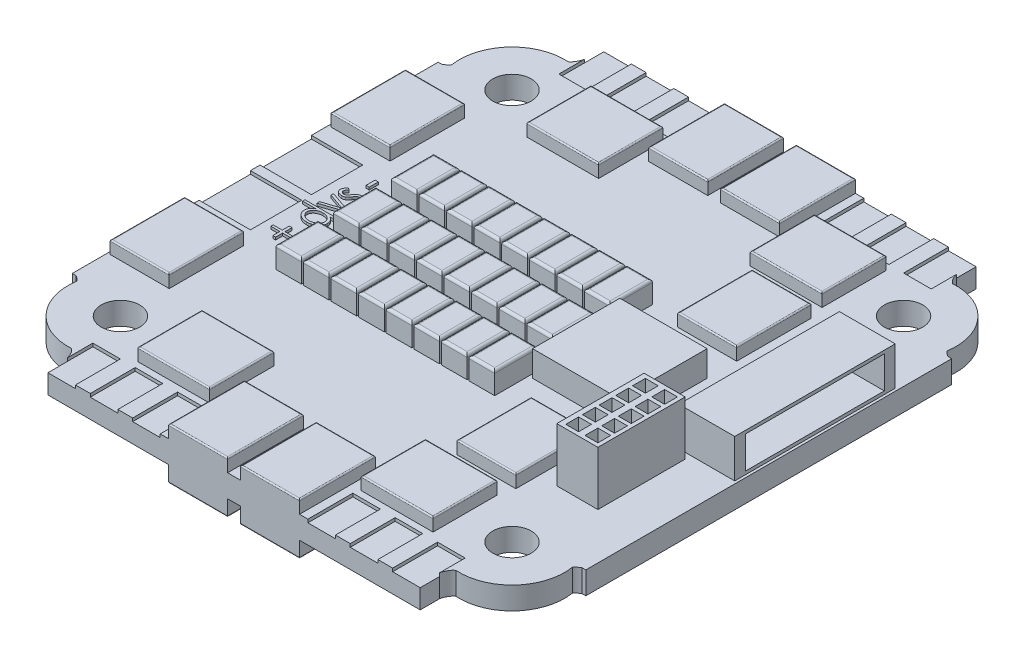
from build123d import *

# Parameters (mm, degrees)
IZIM1_W                          = 40
IZIM1_H                          = 43.3
Y_KSEKLIK_EKSTR_ZYON1_DEPTH      = 1.75
IZIM2_R                          = 1.5
KES_EKSTR_ZYON1_DEPTH            = 1.75
KES_EKSTR_ZYON4_DEPTH            = 1.75
KES_EKSTR_ZYON5_START            = 1.5
IZIM5_W                          = 2.147747616
IZIM5_H                          = 3.5
IZIM5_W_2                        = 2.15
KES_EKSTR_ZYON5_DEPTH            = 1
KES_EKSTR_ZYON7_START            = 1.5
IZIM6_W                          = 4
IZIM6_H                          = 4
KES_EKSTR_ZYON7_DEPTH            = 1
Y_KSEKLIK_EKSTR_ZYON2_DEPTH      = 2.75
Y_KSEKLIK_EKSTR_ZYON2_DEPTH_BACK = 1.25
IZIM7_W                          = 4.6
IZIM7_H                          = 5.8
IZIM9_W                          = 6.8
IZIM9_H                          = 6.8
Y_KSEKLIK_EKSTR_ZYON3_DEPTH      = 3.75
Y_KSEKLIK_EKSTR_ZYON4_DEPTH      = 2.75
Y_KSEKLIK_EKSTR_ZYON4_DEPTH_BACK = 1.25
IZIM10_W                         = 4.597884631
IZIM10_H                         = 5.9
IZIM10_W_2                       = 5.59620667
IZIM10_H_2                       = 5
IZIM11_W                         = 4
IZIM11_H                         = 4
KES_EKSTR_ZYON8_DEPTH            = 0.5
Y_KSEKLIK_EKSTR_ZYON5_START      = 1.75
IZIM12_W                         = 4.35
IZIM12_H                         = 12.5
Y_KSEKLIK_EKSTR_ZYON5_DEPTH      = 3
IZIM13_W                         = 10.8
IZIM13_H                         = 2.5
KES_EKSTR_ZYON9_DEPTH            = 13
Y_KSEKLIK_EKSTR_ZYON6_START      = 1.75
IZIM14_W                         = 3.2
IZIM14_H                         = 6.8
Y_KSEKLIK_EKSTR_ZYON6_DEPTH      = 4.2
IZIM15_W                         = 1
IZIM15_H                         = 1.002257236
KES_EKSTR_ZYON10_DEPTH           = 3
IZIM16_W                         = 2
IZIM16_H                         = 3.3
Y_KSEKLIK_EKSTR_ZYON7_DEPTH      = 3.45
RADYUS1_R                        = 0.2
RADYUS2_R                        = 0.1
IZIM17_W                         = 0.24423077
IZIM17_H                         = 0.702163462
Y_KSEKLIK_EKSTR_ZYON8_DEPTH      = 0.2


with BuildPart() as part:
    # Çizim1 → Yükseklik-Ekstrüzyon1 (new body)
    with BuildSketch(Plane(origin=(0, 0, 0), x_dir=(1, 0, 0), z_dir=(0, 1, 0))):
        Rectangle(IZIM1_W, IZIM1_H)
    extrude(amount=Y_KSEKLIK_EKSTR_ZYON1_DEPTH)

    # Çizim2 → Kes-Ekstrüzyon1 (cut)
    with BuildSketch(Plane(origin=(0, 0, 0), x_dir=(1, 0, 0), z_dir=(0, 1, 0))):
        with Locations(Location((-15.25, 15.25, 0), (0, 0, 270))):
            Circle(IZIM2_R)
        with Locations(Location((15.25, 15.25, 0), (0, 0, 270))):
            Circle(IZIM2_R)
        with Locations(Location((15.25, -15.25, 0), (0, 0, 270))):
            Circle(IZIM2_R)
        with Locations(Location((-15.25, -15.25, 0), (0, 0, 270))):
            Circle(IZIM2_R)
    extrude(amount=KES_EKSTR_ZYON1_DEPTH, mode=Mode.SUBTRACT)

    # Çizim3 → Kes-Ekstrüzyon4 (cut)
    with BuildSketch(Plane(origin=(0, 0, 0), x_dir=(1, 0, 0), z_dir=(0, 1, 0))):
        with BuildLine():
            Line((-19.717750654, 14.25), (-20, 14.25))
            Line((-20, 14.25), (-20, 21.65))
            Line((-20, 21.65), (-14.5, 21.65))
            Line((-14.5, 21.65), (-14.5, 20.13782588))
            add(Edge.make_bspline(
                [(-14.971291716, 19.340516067), (-14.753664146, 19.481272878), (-14.571354318, 19.808969024), (-14.5, 20.13782588)],
                knots=[0, 0, 0, 0, 1, 1, 1, 1], degree=3))
            ThreePointArc((-14.971291716, 19.340516067), (-18.280627176, 18.01139438), (-19.29702263, 14.593031333))
            add(Edge.make_bspline(
                [(-19.29702263, 14.593031333), (-19.433883097, 14.398452939), (-19.717750654, 14.25)],
                knots=[0, 0, 0, 1, 1, 1], degree=2))
        make_face()
        with BuildLine():
            Line((20, 21.65), (14.5, 21.65))
            Line((14.5, 21.65), (14.5, 20.13782588))
            add(Edge.make_bspline(
                [(14.971291716, 19.340516067), (14.753664146, 19.481272878), (14.571354318, 19.808969024), (14.5, 20.13782588)],
                knots=[0, 0, 0, 0, 1, 1, 1, 1], degree=3))
            ThreePointArc((14.971291716, 19.340516067), (18.280627176, 18.01139438), (19.29702263, 14.593031333))
            add(Edge.make_bspline(
                [(19.29702263, 14.593031333), (19.433883097, 14.398452939), (19.717750654, 14.25)],
                knots=[0, 0, 0, 1, 1, 1], degree=2))
            Line((19.717750654, 14.25), (20, 14.25))
            Line((20, 14.25), (20, 21.65))
        make_face()
        with BuildLine():
            Line((19.717750654, -14.25), (20, -14.25))
            Line((20, -14.25), (20, -21.65))
            Line((20, -21.65), (14.5, -21.65))
            Line((14.5, -21.65), (14.5, -20.13782588))
            add(Edge.make_bspline(
                [(14.971291716, -19.340516067), (14.753664146, -19.481272878), (14.571354318, -19.808969024), (14.5, -20.13782588)],
                knots=[0, 0, 0, 0, 1, 1, 1, 1], degree=3))
            ThreePointArc((14.971291716, -19.340516067), (18.280627176, -18.01139438), (19.29702263, -14.593031333))
            add(Edge.make_bspline(
                [(19.29702263, -14.593031333), (19.433883097, -14.398452939), (19.717750654, -14.25)],
                knots=[0, 0, 0, 1, 1, 1], degree=2))
        make_face()
        with BuildLine():
            Line((-20, -21.65), (-14.5, -21.65))
            Line((-14.5, -21.65), (-14.5, -20.13782588))
            add(Edge.make_bspline(
                [(-14.971291716, -19.340516067), (-14.753664146, -19.481272878), (-14.571354318, -19.808969024), (-14.5, -20.13782588)],
                knots=[0, 0, 0, 0, 1, 1, 1, 1], degree=3))
            ThreePointArc((-14.971291716, -19.340516067), (-18.280627176, -18.01139438), (-19.29702263, -14.593031333))
            add(Edge.make_bspline(
                [(-19.29702263, -14.593031333), (-19.433883097, -14.398452939), (-19.717750654, -14.25)],
                knots=[0, 0, 0, 1, 1, 1], degree=2))
            Line((-19.717750654, -14.25), (-20, -14.25))
            Line((-20, -14.25), (-20, -21.65))
        make_face()
    extrude(amount=KES_EKSTR_ZYON4_DEPTH, mode=Mode.SUBTRACT)

    # Çizim5 → Kes-Ekstrüzyon5 (cut)
    with BuildSketch(Plane(origin=(0, 0, 0), x_dir=(1, 0, 0), z_dir=(0, 1, 0)).offset(KES_EKSTR_ZYON5_START)):
        with Locations((-13.426126192, 19.9)):
            Rectangle(IZIM5_W, IZIM5_H)
        with Locations((-6.823873808, 19.9)):
            Rectangle(IZIM5_W, IZIM5_H)
        with Locations((-10.125, 19.9)):
            Rectangle(IZIM5_W_2, IZIM5_H)
        with Locations((10.125, 19.9)):
            Rectangle(IZIM5_W_2, IZIM5_H)
        with Locations((6.823873808, 19.9)):
            Rectangle(IZIM5_W, IZIM5_H)
        with Locations((13.426126192, 19.9)):
            Rectangle(IZIM5_W, IZIM5_H)
        with Locations((13.426126192, -19.9)):
            Rectangle(IZIM5_W, IZIM5_H)
        with Locations((6.823873808, -19.9)):
            Rectangle(IZIM5_W, IZIM5_H)
        with Locations((10.125, -19.9)):
            Rectangle(IZIM5_W_2, IZIM5_H)
        with Locations((-10.125, -19.9)):
            Rectangle(IZIM5_W_2, IZIM5_H)
        with Locations((-6.823873808, -19.9)):
            Rectangle(IZIM5_W, IZIM5_H)
        with Locations((-13.426126192, -19.9)):
            Rectangle(IZIM5_W, IZIM5_H)
    extrude(amount=KES_EKSTR_ZYON5_DEPTH, mode=Mode.SUBTRACT)

    # Çizim6 → Kes-Ekstrüzyon7 (cut)
    with BuildSketch(Plane(origin=(0, 0, 0), x_dir=(1, 0, 0), z_dir=(0, 1, 0)).offset(KES_EKSTR_ZYON7_START)):
        with Locations((-18, -2.375)):
            Rectangle(IZIM6_W, IZIM6_H)
        with Locations((-18, 2.375)):
            Rectangle(IZIM6_W, IZIM6_H)
    extrude(amount=KES_EKSTR_ZYON7_DEPTH, mode=Mode.SUBTRACT)

    # Çizim7 → Yükseklik-Ekstrüzyon2 (add, two sides: drawn at the far end of the back side and taken through both)
    with BuildSketch(Plane(origin=(0, 0, 0), x_dir=(1, 0, 0), z_dir=(0, 1, 0)).offset(-Y_KSEKLIK_EKSTR_ZYON2_DEPTH_BACK)):
        with Locations((-17.5, -8.6)):
            Rectangle(IZIM7_W, IZIM7_H)
        with Locations((-17.5, 8.6)):
            Rectangle(IZIM7_W, IZIM7_H)
        with Locations((9.5, -8.6)):
            Rectangle(IZIM7_W, IZIM7_H)
        with Locations((9.5, 8.6)):
            Rectangle(IZIM7_W, IZIM7_H)
    extrude(amount=Y_KSEKLIK_EKSTR_ZYON2_DEPTH + Y_KSEKLIK_EKSTR_ZYON2_DEPTH_BACK)

    # Çizim9 → Yükseklik-Ekstrüzyon3 (add)
    with BuildSketch(Plane(origin=(0, 0, 0), x_dir=(1, 0, 0), z_dir=(0, 1, 0))):
        with Locations((8.4, 0)):
            Rectangle(IZIM9_W, IZIM9_H)
    extrude(amount=Y_KSEKLIK_EKSTR_ZYON3_DEPTH)

    # Çizim10 → Yükseklik-Ekstrüzyon4 (add, two sides: drawn at the far end of the back side and taken through both)
    with BuildSketch(Plane(origin=(0, 0, 0), x_dir=(1, 0, 0), z_dir=(0, 1, 0)).offset(-Y_KSEKLIK_EKSTR_ZYON4_DEPTH_BACK)):
        with Locations((-2.801057685, 18.7)):
            Rectangle(IZIM10_W, IZIM10_H)
        with Locations((2.801057685, 18.7)):
            Rectangle(IZIM10_W, IZIM10_H)
        with Locations((8.701896665, 15.15)):
            Rectangle(IZIM10_W_2, IZIM10_H_2)
        with Locations((-8.701896665, 15.15)):
            Rectangle(IZIM10_W_2, IZIM10_H_2)
        with Locations((8.701896665, -15.15)):
            Rectangle(IZIM10_W_2, IZIM10_H_2)
        with Locations((-8.701896665, -15.15)):
            Rectangle(IZIM10_W_2, IZIM10_H_2)
        with Locations((-2.801057685, -18.7)):
            Rectangle(IZIM10_W, IZIM10_H)
        with Locations((2.801057685, -18.7)):
            Rectangle(IZIM10_W, IZIM10_H)
    extrude(amount=Y_KSEKLIK_EKSTR_ZYON4_DEPTH + Y_KSEKLIK_EKSTR_ZYON4_DEPTH_BACK)

    # Çizim11 → Kes-Ekstrüzyon8 (cut)
    with BuildSketch(Plane(origin=(0, 0, 0), x_dir=(1, 0, 0), z_dir=(0, 1, 0))):
        with Locations((-18.003680678, -2.654708619)):
            Rectangle(IZIM11_W, IZIM11_H)
        with Locations((-18.003680678, 2.095291381)):
            Rectangle(IZIM11_W, IZIM11_H)
    extrude(amount=KES_EKSTR_ZYON8_DEPTH, mode=Mode.SUBTRACT)

    # Çizim12 → Yükseklik-Ekstrüzyon5 (add)
    with BuildSketch(Plane(origin=(0, 0, 0), x_dir=(1, 0, 0), z_dir=(0, 1, 0)).offset(Y_KSEKLIK_EKSTR_ZYON5_START)):
        with Locations((17.625, 3.8)):
            Rectangle(IZIM12_W, IZIM12_H)
    extrude(amount=Y_KSEKLIK_EKSTR_ZYON5_DEPTH)

    # Çizim13 → Kes-Ekstrüzyon9 (cut)
    with BuildSketch(Plane(origin=(29.8, 0, 0), x_dir=(0, 0, -1), z_dir=(1, 0, 0))):
        with Locations((3.8, 3.25)):
            Rectangle(IZIM13_W, IZIM13_H)
    extrude(amount=-KES_EKSTR_ZYON9_DEPTH, mode=Mode.SUBTRACT)

    # Çizim14 → Yükseklik-Ekstrüzyon6 (add)
    with BuildSketch(Plane(origin=(0, 0, 0), x_dir=(1, 0, 0), z_dir=(0, 1, 0)).offset(Y_KSEKLIK_EKSTR_ZYON6_START)):
        with Locations((14.8, -6.310712731)):
            Rectangle(IZIM14_W, IZIM14_H)
    extrude(amount=Y_KSEKLIK_EKSTR_ZYON6_DEPTH)

    # Çizim15 → Kes-Ekstrüzyon10 (cut)
    with BuildSketch(Plane(origin=(0, 5.95, 0), x_dir=(1, 0, 0), z_dir=(0, 1, 0))):
        with Locations((14.1, -3.711841349)):
            Rectangle(IZIM15_W, IZIM15_H)
        with Locations((15.6, -3.711841349)):
            Rectangle(IZIM15_W, IZIM15_H)
        with Locations((14.1, -5.011841349)):
            Rectangle(IZIM15_W, IZIM15_H)
        with Locations((14.1, -6.311841349)):
            Rectangle(IZIM15_W, IZIM15_H)
        with Locations((14.1, -7.611841349)):
            Rectangle(IZIM15_W, IZIM15_H)
        with Locations((14.1, -8.911841349)):
            Rectangle(IZIM15_W, IZIM15_H)
        with Locations((15.6, -5.011841349)):
            Rectangle(IZIM15_W, IZIM15_H)
        with Locations((15.6, -6.311841349)):
            Rectangle(IZIM15_W, IZIM15_H)
        with Locations((15.6, -7.611841349)):
            Rectangle(IZIM15_W, IZIM15_H)
        with Locations((15.6, -8.911841349)):
            Rectangle(IZIM15_W, IZIM15_H)
    extrude(amount=-KES_EKSTR_ZYON10_DEPTH, mode=Mode.SUBTRACT)

    # Çizim16 → Yükseklik-Ekstrüzyon7 (add)
    with BuildSketch(Plane(origin=(0, 0, 0), x_dir=(1, 0, 0), z_dir=(0, 1, 0))):
        with Locations((1.55, 4.6)):
            Rectangle(IZIM16_W, IZIM16_H)
        with Locations((3.7, 4.6)):
            Rectangle(IZIM16_W, IZIM16_H)
        with Locations((-0.6, 4.6)):
            Rectangle(IZIM16_W, IZIM16_H)
        with Locations((-2.75, 4.6)):
            Rectangle(IZIM16_W, IZIM16_H)
        with Locations((-4.9, 4.6)):
            Rectangle(IZIM16_W, IZIM16_H)
        with Locations((-7.05, 4.6)):
            Rectangle(IZIM16_W, IZIM16_H)
        with Locations((-9.2, 4.6)):
            Rectangle(IZIM16_W, IZIM16_H)
        with Locations((-11.35, 4.6)):
            Rectangle(IZIM16_W, IZIM16_H)
        with Locations((1.55, 0.1)):
            Rectangle(IZIM16_W, IZIM16_H)
        with Locations((-0.6, 0.1)):
            Rectangle(IZIM16_W, IZIM16_H)
        with Locations((-2.75, 0.1)):
            Rectangle(IZIM16_W, IZIM16_H)
        with Locations((-4.9, 0.1)):
            Rectangle(IZIM16_W, IZIM16_H)
        with Locations((-7.05, 0.1)):
            Rectangle(IZIM16_W, IZIM16_H)
        with Locations((-9.2, 0.1)):
            Rectangle(IZIM16_W, IZIM16_H)
        with Locations((-11.35, 0.1)):
            Rectangle(IZIM16_W, IZIM16_H)
        with Locations((1.55, -4.4)):
            Rectangle(IZIM16_W, IZIM16_H)
        with Locations((-0.6, -4.4)):
            Rectangle(IZIM16_W, IZIM16_H)
        with Locations((-2.75, -4.4)):
            Rectangle(IZIM16_W, IZIM16_H)
        with Locations((-4.9, -4.4)):
            Rectangle(IZIM16_W, IZIM16_H)
        with Locations((-7.05, -4.4)):
            Rectangle(IZIM16_W, IZIM16_H)
        with Locations((-9.2, -4.4)):
            Rectangle(IZIM16_W, IZIM16_H)
        with Locations((-11.35, -4.4)):
            Rectangle(IZIM16_W, IZIM16_H)
        with Locations((3.7, 0.1)):
            Rectangle(IZIM16_W, IZIM16_H)
        with Locations((3.7, -4.4)):
            Rectangle(IZIM16_W, IZIM16_H)
    extrude(amount=Y_KSEKLIK_EKSTR_ZYON7_DEPTH)

    # Radyus1
    radyus1_edges = [part.edges().sort_by_distance(p)[0] for p in [
        (0.4, 3.45, -0.1),
        (-0.6, 3.45, -1.75),
        (-1.6, 3.45, -0.1),
        (-0.6, 3.45, 1.55),
        (-1.75, 3.45, -0.1),
        (-2.75, 3.45, -1.75),
        (-3.75, 3.45, -0.1),
        (-2.75, 3.45, 1.55),
        (-3.9, 3.45, -0.1),
        (-4.9, 3.45, -1.75),
        (-5.9, 3.45, -0.1),
        (-4.9, 3.45, 1.55),
        (-6.05, 3.45, -0.1),
        (-7.05, 3.45, -1.75),
        (-8.05, 3.45, -0.1),
        (-7.05, 3.45, 1.55),
        (-8.2, 3.45, -0.1),
        (-9.2, 3.45, -1.75),
        (-10.2, 3.45, -0.1),
        (-9.2, 3.45, 1.55),
        (-10.35, 3.45, -0.1),
        (-11.35, 3.45, -1.75),
        (-12.35, 3.45, -0.1),
        (-11.35, 3.45, 1.55),
        (2.55, 3.45, 4.4),
        (1.55, 3.45, 2.75),
        (0.55, 3.45, 4.4),
        (1.55, 3.45, 6.05),
        (0.4, 3.45, 4.4),
        (-0.6, 3.45, 2.75),
        (-1.6, 3.45, 4.4),
        (-0.6, 3.45, 6.05),
        (-1.75, 3.45, 4.4),
        (-2.75, 3.45, 2.75),
        (-3.75, 3.45, 4.4),
        (-2.75, 3.45, 6.05),
        (-3.9, 3.45, 4.4),
        (-4.9, 3.45, 2.75),
        (-5.9, 3.45, 4.4),
        (-4.9, 3.45, 6.05),
        (-6.05, 3.45, 4.4),
        (-7.05, 3.45, 2.75),
        (-8.05, 3.45, 4.4),
        (-7.05, 3.45, 6.05),
        (-8.2, 3.45, 4.4),
        (-9.2, 3.45, 2.75),
        (-10.2, 3.45, 4.4),
        (-9.2, 3.45, 6.05),
        (-10.35, 3.45, 4.4),
        (-11.35, 3.45, 2.75),
        (-12.35, 3.45, 4.4),
        (-11.35, 3.45, 6.05),
        (4.7, 3.45, -0.1),
        (3.7, 3.45, -1.75),
        (2.7, 3.45, -0.1),
        (3.7, 3.45, 1.55),
        (4.7, 3.45, 4.4),
        (3.7, 3.45, 2.75),
        (2.7, 3.45, 4.4),
        (3.7, 3.45, 6.05),
        (4.7, 3.45, -4.6),
        (3.7, 3.45, -6.25),
        (2.7, 3.45, -4.6),
        (3.7, 3.45, -2.95),
        (2.55, 3.45, -4.6),
        (1.55, 3.45, -6.25),
        (0.55, 3.45, -4.6),
        (1.55, 3.45, -2.95),
        (0.4, 3.45, -4.6),
        (-0.6, 3.45, -6.25),
        (-1.6, 3.45, -4.6),
        (-0.6, 3.45, -2.95),
        (-1.75, 3.45, -4.6),
        (-2.75, 3.45, -6.25),
        (-3.75, 3.45, -4.6),
        (-2.75, 3.45, -2.95),
        (-3.9, 3.45, -4.6),
        (-4.9, 3.45, -6.25),
        (-5.9, 3.45, -4.6),
        (-4.9, 3.45, -2.95),
        (-6.05, 3.45, -4.6),
        (-7.05, 3.45, -6.25),
        (-8.05, 3.45, -4.6),
        (-7.05, 3.45, -2.95),
        (-8.2, 3.45, -4.6),
        (-9.2, 3.45, -6.25),
        (-10.2, 3.45, -4.6),
        (-9.2, 3.45, -2.95),
        (-10.35, 3.45, -4.6),
        (-11.35, 3.45, -6.25),
        (-12.35, 3.45, -4.6),
        (-11.35, 3.45, -2.95),
        (2.55, 3.45, -0.1),
        (1.55, 3.45, -1.75),
        (0.55, 3.45, -0.1),
        (1.55, 3.45, 1.55),
    ]]
    fillet(radyus1_edges, radius=RADYUS1_R)

    # Radyus2
    radyus2_edges = [part.edges().sort_by_distance(p)[0] for p in [
        (-15.2, -1.25, 8.6),
        (-17.5, -1.25, 11.5),
        (-19.8, -1.25, 8.6),
        (-17.5, -1.25, 5.7),
        (-15.2, 2.75, 8.6),
        (-17.5, 2.75, 5.7),
        (-19.8, 2.75, 8.6),
        (-17.5, 2.75, 11.5),
        (-15.2, -1.25, -8.6),
        (-17.5, -1.25, -5.7),
        (-19.8, -1.25, -8.6),
        (-17.5, -1.25, -11.5),
        (-15.2, 2.75, -8.6),
        (-17.5, 2.75, -11.5),
        (-19.8, 2.75, -8.6),
        (-17.5, 2.75, -5.7),
        (9.5, -1.25, 11.5),
        (7.2, -1.25, 8.6),
        (9.5, -1.25, 5.7),
        (11.8, -1.25, 8.6),
        (9.5, 2.75, 11.5),
        (11.8, 2.75, 8.6),
        (9.5, 2.75, 5.7),
        (7.2, 2.75, 8.6),
        (9.5, -1.25, -11.5),
        (11.8, -1.25, -8.6),
        (9.5, -1.25, -5.7),
        (7.2, -1.25, -8.6),
        (9.5, 2.75, -11.5),
        (7.2, 2.75, -8.6),
        (9.5, 2.75, -5.7),
        (11.8, 2.75, -8.6),
        (-5.1, 2.75, -18.7),
        (-2.801057684, 2.75, -15.75),
        (-0.502115369, 2.75, -18.7),
        (-2.801057684, 2.75, -21.65),
        (2.801057684, 2.75, -15.75),
        (5.1, 2.75, -18.7),
        (2.801057684, 2.75, -21.65),
        (0.502115369, 2.75, -18.7),
        (-11.5, -1.25, -15.15),
        (-8.701896665, -1.25, -17.65),
        (-5.90379333, -1.25, -15.15),
        (-8.701896665, -1.25, -12.65),
        (-11.5, 2.75, -15.15),
        (-8.701896665, 2.75, -12.65),
        (-5.90379333, 2.75, -15.15),
        (-8.701896665, 2.75, -17.65),
        (8.701896665, -1.25, -12.65),
        (5.90379333, -1.25, -15.15),
        (8.701896665, -1.25, -17.65),
        (11.5, -1.25, -15.15),
        (8.701896665, 2.75, -12.65),
        (11.5, 2.75, -15.15),
        (8.701896665, 2.75, -17.65),
        (5.90379333, 2.75, -15.15),
        (11.5, -1.25, 15.15),
        (8.701896665, -1.25, 17.65),
        (5.90379333, -1.25, 15.15),
        (8.701896665, -1.25, 12.65),
        (11.5, 2.75, 15.15),
        (8.701896665, 2.75, 12.65),
        (5.90379333, 2.75, 15.15),
        (8.701896665, 2.75, 17.65),
        (-11.5, -1.25, 15.15),
        (-8.701896665, -1.25, 12.65),
        (-5.90379333, -1.25, 15.15),
        (-8.701896665, -1.25, 17.65),
        (-11.5, 2.75, 15.15),
        (-8.701896665, 2.75, 17.65),
        (-5.90379333, 2.75, 15.15),
        (-8.701896665, 2.75, 12.65),
        (2.801057684, -1.25, 21.65),
        (0.502115369, -1.25, 18.7),
        (2.801057684, -1.25, 15.75),
        (5.1, -1.25, 18.7),
        (2.801057684, 2.75, 21.65),
        (5.1, 2.75, 18.7),
        (2.801057684, 2.75, 15.75),
        (0.502115369, 2.75, 18.7),
        (-2.801057684, -1.25, 15.75),
        (-0.502115369, -1.25, 18.7),
        (-2.801057684, -1.25, 21.65),
        (-5.1, -1.25, 18.7),
        (-2.801057684, 2.75, 15.75),
        (-5.1, 2.75, 18.7),
        (-2.801057684, 2.75, 21.65),
        (-0.502115369, 2.75, 18.7),
    ]]
    fillet(radyus2_edges, radius=RADYUS2_R)

    # Çizim17 → Yükseklik-Ekstrüzyon8 (add)
    # profile 1 of 5: a face of its own
    with BuildSketch(Plane(origin=(0, 1.75, 0), x_dir=(1, 0, 0), z_dir=(0, 1, 0))):
        Polygon((-14.545757748, -3.534220415), (-15.247921209, -3.534220415), (-15.247921209, -3.351047338), (-14.545757748, -3.351047338), (-14.545757748, -2.801528107), (-14.332055825, -2.801528107), (-14.332055825, -3.351047338), (-13.629892363, -3.351047338), (-13.629892363, -3.534220415), (-14.332055825, -3.534220415), (-14.332055825, -4.083739645), (-14.545757748, -4.083739645), align=None)
    # profile 2 of 5: a face of its own
    with BuildSketch(Plane(origin=(0, 1.75, 0), x_dir=(1, 0, 0), z_dir=(0, 1, 0))):
        with BuildLine():
            Line((-15.705853902, -0.420278107), (-13.263546209, -0.420278107))
            Line((-13.263546209, -0.420278107), (-13.263546209, -0.603451184))
            Line((-13.263546209, -0.603451184), (-13.564541552, -0.603451184))
            add(Edge.make_bspline(
                [(-13.564541552, -0.603451184), (-13.53746896, -0.622039409), (-13.485206737, -0.657923005), (-13.415276505, -0.717920722), (-13.357973194, -0.782577607), (-13.311447669, -0.850219237), (-13.276384877, -0.92156596), (-13.251512393, -0.995845728), (-13.235399772, -1.073252432), (-13.233818078, -1.126177633), (-13.233017363, -1.152970415)],
                knots=[0, 0, 0, 0, 1.172747878, 2.263928442, 3.281922024, 4.25087268, 5.188273431, 6.111575823, 7.044006704, 8, 8, 8, 8], degree=3))
            add(Edge.make_bspline(
                [(-13.233017363, -1.152970415), (-13.233851804, -1.176876084), (-13.235498799, -1.224060412), (-13.248319133, -1.293283332), (-13.268974441, -1.359738997), (-13.297844754, -1.423728702), (-13.335207201, -1.484904231), (-13.381215798, -1.542968139), (-13.435037905, -1.598587724), (-13.496490458, -1.650815016), (-13.563766709, -1.698552984), (-13.635064437, -1.740903658), (-13.710308742, -1.776321186), (-13.789292543, -1.804823982), (-13.871611769, -1.827271661), (-13.957388291, -1.843571182), (-14.046742426, -1.853149529), (-14.107518572, -1.854465472), (-14.138388457, -1.855133876)],
                knots=[0, 0, 0, 0, 0.903163779, 1.78263887, 2.651389892, 3.528335299, 4.429236434, 5.353843816, 6.32297284, 7.350379706, 8.397704944, 9.43776181, 10.480939894, 11.536168289, 12.607837322, 13.702913536, 14.833246301, 16, 16, 16, 16], degree=3))
            add(Edge.make_bspline(
                [(-14.138388457, -1.855133876), (-14.16862298, -1.854462767), (-14.228289742, -1.853138356), (-14.316052745, -1.84355125), (-14.400622454, -1.827316159), (-14.481653373, -1.804398577), (-14.559507991, -1.775318543), (-14.633660184, -1.739115665), (-14.705001104, -1.697348132), (-14.771711501, -1.648855802), (-14.83273915, -1.596068044), (-14.886497813, -1.540095364), (-14.932478433, -1.481777235), (-14.969345382, -1.420032406), (-14.998831008, -1.356038427), (-15.019511317, -1.289019636), (-15.0315588, -1.219392803), (-15.033326256, -1.172097059), (-15.034219286, -1.148200282)],
                knots=[0, 0, 0, 0, 1.147764703, 2.265073058, 3.347188514, 4.413563271, 5.458552615, 6.498034846, 7.542675396, 8.593229709, 9.624528646, 10.602280619, 11.535718512, 12.43746343, 13.326263971, 14.204609005, 15.092855845, 16, 16, 16, 16], degree=3))
            add(Edge.make_bspline(
                [(-15.034219286, -1.148200282), (-15.03315849, -1.120757521), (-15.031064667, -1.066590363), (-15.01317639, -0.987458727), (-14.984448014, -0.912314174), (-14.94366916, -0.841261231), (-14.891068499, -0.774827569), (-14.827191093, -0.712360964), (-14.752192023, -0.653963462), (-14.695944499, -0.62064467), (-14.666919106, -0.603451184)],
                knots=[0, 0, 0, 0, 0.951594992, 1.878280231, 2.800748451, 3.735175227, 4.710076232, 5.732587844, 6.829948001, 8, 8, 8, 8], degree=3))
            Line((-14.666919106, -0.603451184), (-15.705853902, -0.603451184))
            Line((-15.705853902, -0.603451184), (-15.705853902, -0.420278107))
        make_face()
        with BuildLine():
            add(Edge.make_bspline(
                [(-14.820517363, -1.137228978), (-14.819420258, -1.161023437), (-14.817249774, -1.208097783), (-14.799623284, -1.277242554), (-14.771320096, -1.34337394), (-14.73178181, -1.406213771), (-14.682054964, -1.464079491), (-14.623355784, -1.516871119), (-14.554690888, -1.561812428), (-14.479109207, -1.601284999), (-14.397338434, -1.632292486), (-14.312417071, -1.655431692), (-14.224844805, -1.669018012), (-14.165782893, -1.670974382), (-14.136003391, -1.671960799)],
                knots=[0, 0, 0, 0, 0.890056594, 1.76086514, 2.654499465, 3.574716069, 4.529255787, 5.503372661, 6.520644566, 7.593881512, 8.690822744, 9.788539383, 10.884963373, 12, 12, 12, 12], degree=3))
            add(Edge.make_bspline(
                [(-14.136003391, -1.671960799), (-14.106383807, -1.670964688), (-14.047482925, -1.668983843), (-13.960213701, -1.655487686), (-13.875117445, -1.632168295), (-13.793038322, -1.600687807), (-13.71623337, -1.561431133), (-13.646783803, -1.515881745), (-13.587240459, -1.462844067), (-13.536835274, -1.404592593), (-13.496604567, -1.342036865), (-13.468158298, -1.27609803), (-13.449932596, -1.208009264), (-13.447792757, -1.161509865), (-13.446719286, -1.138183005)],
                knots=[0, 0, 0, 0, 1.107208297, 2.201771173, 3.291886461, 4.400195165, 5.482177094, 6.510909783, 7.496205014, 8.452991324, 9.383017846, 10.264216512, 11.12922794, 12, 12, 12, 12], degree=3))
            add(Edge.make_bspline(
                [(-13.446719286, -1.138183005), (-13.447857026, -1.114713854), (-13.450130437, -1.067818208), (-13.467574577, -0.998420579), (-13.496607555, -0.931354073), (-13.536409411, -0.867162241), (-13.58521454, -0.807222349), (-13.642903693, -0.753971717), (-13.708719341, -0.708130713), (-13.782127021, -0.670339639), (-13.861868661, -0.640329223), (-13.946837461, -0.618978492), (-14.03668716, -0.605750756), (-14.098272569, -0.604229841), (-14.129802219, -0.603451184)],
                knots=[0, 0, 0, 0, 0.876430904, 1.751268901, 2.656380427, 3.598087967, 4.565158369, 5.536527855, 6.522331019, 7.553563889, 8.614202314, 9.699457988, 10.822200185, 12, 12, 12, 12], degree=3))
            add(Edge.make_bspline(
                [(-14.129802219, -0.603451184), (-14.15383177, -0.603886416), (-14.201046488, -0.604741587), (-14.270383846, -0.612153212), (-14.336863918, -0.623681794), (-14.400014899, -0.641286258), (-14.460590527, -0.662439066), (-14.517693317, -0.689409114), (-14.57220675, -0.720446515), (-14.622657226, -0.756481086), (-14.668834896, -0.795865133), (-14.709531274, -0.837652891), (-14.74389388, -0.881930175), (-14.771648544, -0.928646151), (-14.794103166, -0.977415029), (-14.808934522, -1.028920024), (-14.819228851, -1.082279942), (-14.820083668, -1.118733892), (-14.820517363, -1.137228978)],
                knots=[0, 0, 0, 0, 1.188172481, 2.334593263, 3.445282313, 4.521295281, 5.57350723, 6.614936672, 7.640145624, 8.672298908, 9.676294346, 10.638484653, 11.55241243, 12.441226742, 13.321194475, 14.199508958, 15.086512205, 16, 16, 16, 16], degree=3))
        make_face(mode=Mode.SUBTRACT)
    # profile 3 of 5: a face of its own
    with BuildSketch(Plane(origin=(0, 1.75, 0), x_dir=(1, 0, 0), z_dir=(0, 1, 0))):
        Polygon((-15.00369044, -0.176047338), (-15.00369044, 0.024298215), (-13.696197201, 0.453133101), (-15.00369044, 0.905818648), (-15.00369044, 1.106164201), (-12.62244044, 0.281885355), (-12.62244044, 0.081539802), (-13.399494977, 0.350098245), align=None)
    # profile 4 of 5: a face of its own
    with BuildSketch(Plane(origin=(0, 1.75, 0), x_dir=(1, 0, 0), z_dir=(0, 1, 0))):
        with BuildLine():
            Line((-14.786649424, 2.052558432), (-14.637344286, 1.939983311))
            add(Edge.make_bspline(
                [(-14.637344286, 1.939983311), (-14.651824071, 1.92890169), (-14.679626729, 1.907623852), (-14.716975331, 1.873666227), (-14.748596779, 1.839848447), (-14.774599261, 1.806398531), (-14.79527472, 1.773166291), (-14.809539041, 1.739692645), (-14.818781353, 1.7064205), (-14.819947171, 1.684200527), (-14.820517363, 1.673332921)],
                knots=[0, 0, 0, 0, 1.306439345, 2.508496321, 3.613260685, 4.620812336, 5.541400319, 6.409338993, 7.222020771, 8, 8, 8, 8], degree=3))
            add(Edge.make_bspline(
                [(-14.820517363, 1.673332921), (-14.819744591, 1.660018914), (-14.818204722, 1.63348868), (-14.804052937, 1.595563014), (-14.781375783, 1.560947389), (-14.750884869, 1.530356113), (-14.714608113, 1.50502285), (-14.674536139, 1.485996808), (-14.631273657, 1.474715892), (-14.601474804, 1.473254411), (-14.586303872, 1.472510355)],
                knots=[0, 0, 0, 0, 0.933863505, 1.860868679, 2.807176705, 3.827539879, 4.879540348, 5.905345823, 6.933587894, 8, 8, 8, 8], degree=3))
            add(Edge.make_bspline(
                [(-14.586303872, 1.472510355), (-14.572556441, 1.472940988), (-14.54519448, 1.473798092), (-14.50516477, 1.484491168), (-14.465345651, 1.498657934), (-14.440910713, 1.513549051), (-14.428412495, 1.521165703)],
                knots=[0, 0, 0, 0, 0.98233681, 1.955177088, 2.954094317, 4, 4, 4, 4], degree=3))
            add(Edge.make_bspline(
                [(-14.428412495, 1.521165703), (-14.414738646, 1.531296874), (-14.384499303, 1.553701678), (-14.34197313, 1.599803841), (-14.295393769, 1.657764996), (-14.265250869, 1.702334719), (-14.249055524, 1.726281388)],
                knots=[0, 0, 0, 0, 0.743872285, 1.645053101, 2.734720995, 4, 4, 4, 4], degree=3))
            add(Edge.make_bspline(
                [(-14.249055524, 1.726281388), (-14.238664348, 1.741617975), (-14.218514928, 1.77135699), (-14.187477549, 1.813480285), (-14.156554638, 1.85179728), (-14.125480446, 1.885848958), (-14.095663351, 1.916884582), (-14.0652048, 1.943125498), (-14.035468367, 1.966253399), (-14.014795209, 1.979102552), (-14.004824755, 1.985299567)],
                knots=[0, 0, 0, 0, 1.238690231, 2.401931283, 3.497917914, 4.529283228, 5.484150422, 6.373358913, 7.21548754, 8, 8, 8, 8], degree=3))
            add(Edge.make_bspline(
                [(-14.004824755, 1.985299567), (-13.984580107, 1.99578617), (-13.943847676, 2.016885319), (-13.877528777, 2.037197457), (-13.807853713, 2.050180435), (-13.760178689, 2.051753625), (-13.735789298, 2.052558432)],
                knots=[0, 0, 0, 0, 0.974368447, 1.960438955, 2.956609841, 4, 4, 4, 4], degree=3))
            add(Edge.make_bspline(
                [(-13.735789298, 2.052558432), (-13.718598254, 2.052216948), (-13.684754453, 2.051544674), (-13.635038543, 2.045487793), (-13.587268597, 2.036702094), (-13.541384832, 2.02372883), (-13.497752117, 2.006506697), (-13.456081587, 1.985967809), (-13.416360599, 1.961869047), (-13.379410503, 1.933951659), (-13.344825663, 1.90387423), (-13.315426189, 1.870645318), (-13.289654285, 1.836311673), (-13.269126281, 1.799638326), (-13.252654711, 1.761342985), (-13.24121518, 1.720942606), (-13.234453501, 1.678649475), (-13.23350138, 1.649824981), (-13.233017363, 1.635171863)],
                knots=[0, 0, 0, 0, 1.133783037, 2.232064898, 3.299912731, 4.336008522, 5.372422932, 6.390516929, 7.398070579, 8.432465411, 9.443072923, 10.416232299, 11.354147209, 12.270216781, 13.182132094, 14.09862206, 15.033422235, 16, 16, 16, 16], degree=3))
            add(Edge.make_bspline(
                [(-13.233017363, 1.635171863), (-13.23368412, 1.615387912), (-13.235008612, 1.576087699), (-13.247795134, 1.518099891), (-13.267210672, 1.4613576), (-13.295201816, 1.406841547), (-13.329054231, 1.35498544), (-13.370002805, 1.307818735), (-13.415925949, 1.264430712), (-13.450982718, 1.240398874), (-13.468661894, 1.228279585)],
                knots=[0, 0, 0, 0, 0.967740958, 1.922387744, 2.895285857, 3.898388969, 4.915781678, 5.921029111, 6.951572178, 8, 8, 8, 8], degree=3))
            Line((-13.468661894, 1.228279585), (-13.629892363, 1.338469639))
            add(Edge.make_bspline(
                [(-13.629892363, 1.338469639), (-13.615396384, 1.349370622), (-13.587490494, 1.370355864), (-13.550148054, 1.404363558), (-13.518355399, 1.438718084), (-13.492329395, 1.47367518), (-13.471816097, 1.509285342), (-13.457567738, 1.545631486), (-13.448370102, 1.582406298), (-13.447267502, 1.607135169), (-13.446719286, 1.619430427)],
                knots=[0, 0, 0, 0, 1.249338816, 2.405074618, 3.475318477, 4.470274505, 5.402622068, 6.297918227, 7.153720577, 8, 8, 8, 8], degree=3))
            add(Edge.make_bspline(
                [(-13.446719286, 1.619430427), (-13.447674982, 1.636261025), (-13.449558177, 1.669425651), (-13.466203927, 1.716694484), (-13.49279791, 1.760001719), (-13.529416024, 1.797626371), (-13.572331061, 1.829514726), (-13.620292722, 1.85292267), (-13.672399893, 1.866559479), (-13.70836113, 1.86843007), (-13.726726047, 1.869385355)],
                knots=[0, 0, 0, 0, 0.968458622, 1.908343873, 2.855453285, 3.880639528, 4.917253359, 5.926515418, 6.941099486, 8, 8, 8, 8], degree=3))
            add(Edge.make_bspline(
                [(-13.726726047, 1.869385355), (-13.741885173, 1.868913116), (-13.771537147, 1.867989394), (-13.81473588, 1.858387409), (-13.855591799, 1.843444822), (-13.880366464, 1.828608782), (-13.892726648, 1.821207019)],
                knots=[0, 0, 0, 0, 1.036227379, 2.026910152, 3.015617245, 4, 4, 4, 4], degree=3))
            add(Edge.make_bspline(
                [(-13.892726648, 1.821207019), (-13.898873841, 1.816721763), (-13.912209872, 1.806991221), (-13.931256527, 1.788499473), (-13.952487129, 1.767360686), (-13.973883654, 1.741372532), (-13.99711834, 1.712360772), (-14.020937788, 1.678997338), (-14.046276978, 1.642298257), (-14.063240712, 1.616291727), (-14.072083619, 1.602734964)],
                knots=[0, 0, 0, 0, 0.64198877, 1.392762971, 2.238016028, 3.171781159, 4.233111429, 5.37752381, 6.632947586, 8, 8, 8, 8], degree=3))
            add(Edge.make_bspline(
                [(-14.072083619, 1.602734964), (-14.091590189, 1.574345865), (-14.12834933, 1.520848048), (-14.188235771, 1.451344553), (-14.247043603, 1.395193882), (-14.289644167, 1.367950269), (-14.309636203, 1.355165102)],
                knots=[0, 0, 0, 0, 1.193761487, 2.249582949, 3.178546068, 4, 4, 4, 4], degree=3))
            add(Edge.make_bspline(
                [(-14.309636203, 1.355165102), (-14.329579905, 1.345028649), (-14.369776266, 1.324598713), (-14.435518721, 1.304584033), (-14.505181946, 1.291722089), (-14.55317042, 1.290144335), (-14.577717634, 1.289337278)],
                knots=[0, 0, 0, 0, 0.960950054, 1.936786705, 2.944618726, 4, 4, 4, 4], degree=3))
            add(Edge.make_bspline(
                [(-14.577717634, 1.289337278), (-14.593784975, 1.289780479), (-14.625194849, 1.290646889), (-14.671372658, 1.295183679), (-14.715278189, 1.304100114), (-14.757580162, 1.315244349), (-14.797651287, 1.330566032), (-14.835430478, 1.349456096), (-14.871622854, 1.370678476), (-14.90460526, 1.396150356), (-14.935187303, 1.423357895), (-14.961543746, 1.453280841), (-14.984270223, 1.484749378), (-15.002272509, 1.518419634), (-15.016879233, 1.553321572), (-15.026827504, 1.590213529), (-15.033280572, 1.628741734), (-15.033903807, 1.655179902), (-15.034219286, 1.668562789)],
                knots=[0, 0, 0, 0, 1.163801421, 2.275102988, 3.354452776, 4.404669307, 5.439627643, 6.454015416, 7.461058159, 8.47197681, 9.466435164, 10.420689067, 11.353587904, 12.270650064, 13.17936225, 14.087198709, 15.031748201, 16, 16, 16, 16], degree=3))
            add(Edge.make_bspline(
                [(-15.034219286, 1.668562789), (-15.033466906, 1.684529107), (-15.031943246, 1.716862846), (-15.019778143, 1.76529977), (-15.000071831, 1.813556841), (-14.972198033, 1.861655883), (-14.937190212, 1.909911916), (-14.894322321, 1.958058101), (-14.844058478, 2.006556513), (-14.806310926, 2.036803655), (-14.786649424, 2.052558432)],
                knots=[0, 0, 0, 0, 0.81018841, 1.640730093, 2.521060061, 3.450651814, 4.457088456, 5.544274266, 6.720890381, 8, 8, 8, 8], degree=3))
        make_face()
    # profile 5 of 5: a face of its own
    with BuildSketch(Plane(origin=(0, 1.75, 0), x_dir=(1, 0, 0), z_dir=(0, 1, 0))):
        with Locations((-14.179411594, 3.288976701)):
            Rectangle(IZIM17_W, IZIM17_H)
    extrude(amount=Y_KSEKLIK_EKSTR_ZYON8_DEPTH)


solid = part.part
